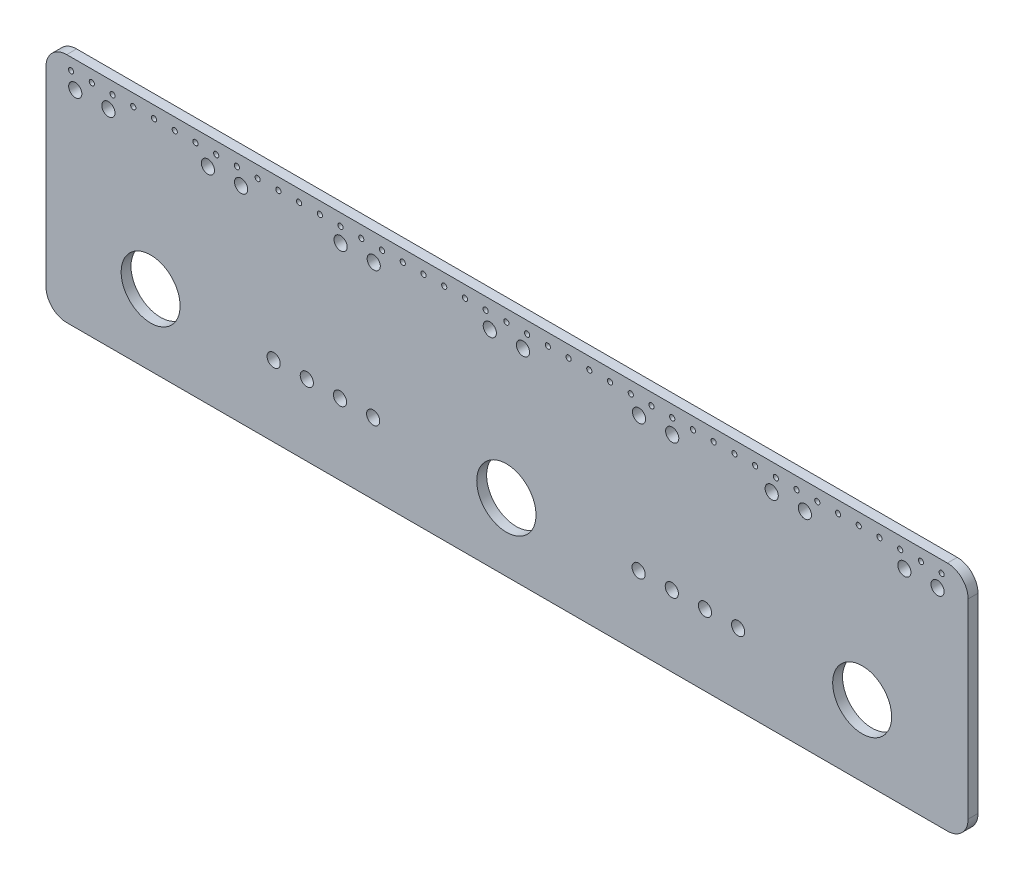
from build123d import *

# Parameters (mm, degrees)
SKETCH1_R           = 3.18
SKETCH1_R_2         = 14.225
SKETCH1_R_3         = 14.3
SKETCH1_R_4         = 1.25
BOSS_EXTRUDE1_DEPTH = 4.7625


with BuildPart() as part:
    # Sketch1 → Boss-Extrude1 (new body)
    with BuildSketch(Plane.XY):
        with BuildLine():
            Line((-577.364254813, 112.684707092), (-152.484254813, 112.684707092))
            ThreePointArc((-152.484254813, 112.684707092), (-145.413187001, 109.755774904), (-142.484254813, 102.684707092))
            Line((-142.484254813, 102.684707092), (-142.484254813, 10.684707092))
            ThreePointArc((-142.484254813, 10.684707092), (-145.413187001, 3.61363928), (-152.484254813, 0.684707092))
            Line((-152.484254813, 0.684707092), (-577.364254813, 0.684707092))
            ThreePointArc((-577.364254813, 0.684707092), (-584.435322625, 3.61363928), (-587.364254813, 10.684707092))
            Line((-587.364254813, 10.684707092), (-587.364254813, 102.684707092))
            ThreePointArc((-587.364254813, 102.684707092), (-584.435322625, 109.755774904), (-577.364254813, 112.684707092))
        make_face()
        with Locations((-301.253013333, 99.934707092)):
            Circle(SKETCH1_R, mode=Mode.SUBTRACT)
        with Locations((-285.253013333, 99.934707092)):
            Circle(SKETCH1_R, mode=Mode.SUBTRACT)
        with Locations((-237.253013333, 99.934707092)):
            Circle(SKETCH1_R, mode=Mode.SUBTRACT)
        with Locations((-221.253013333, 99.934707092)):
            Circle(SKETCH1_R, mode=Mode.SUBTRACT)
        with Locations((-173.253013333, 99.934707092)):
            Circle(SKETCH1_R, mode=Mode.SUBTRACT)
        with Locations((-157.253013333, 99.934707092)):
            Circle(SKETCH1_R, mode=Mode.SUBTRACT)
        with Locations((-445.253013333, 99.934707092)):
            Circle(SKETCH1_R, mode=Mode.SUBTRACT)
        with Locations((-429.253013333, 99.934707092)):
            Circle(SKETCH1_R, mode=Mode.SUBTRACT)
        with Locations((-509.253013333, 99.934707092)):
            Circle(SKETCH1_R, mode=Mode.SUBTRACT)
        with Locations((-493.253013333, 99.934707092)):
            Circle(SKETCH1_R, mode=Mode.SUBTRACT)
        with Locations((-573.253013333, 99.934707092)):
            Circle(SKETCH1_R, mode=Mode.SUBTRACT)
        with Locations((-557.253013333, 99.934707092)):
            Circle(SKETCH1_R, mode=Mode.SUBTRACT)
        with Locations((-357.253013333, 99.934707092)):
            Circle(SKETCH1_R, mode=Mode.SUBTRACT)
        with Locations((-373.253013333, 99.934707092)):
            Circle(SKETCH1_R, mode=Mode.SUBTRACT)
        with Locations((-536.893013333, 34.984707092)):
            Circle(SKETCH1_R_2, mode=Mode.SUBTRACT)
        with Locations((-193.613013333, 34.984707092)):
            Circle(SKETCH1_R_2, mode=Mode.SUBTRACT)
        with Locations((-365.253013333, 33.484707092)):
            Circle(SKETCH1_R_3, mode=Mode.SUBTRACT)
        with Locations((-477.53401176, 34.984707092)):
            Circle(SKETCH1_R, mode=Mode.SUBTRACT)
        with Locations((-461.53401176, 34.984707092)):
            Circle(SKETCH1_R, mode=Mode.SUBTRACT)
        with Locations((-445.53401176, 34.984707092)):
            Circle(SKETCH1_R, mode=Mode.SUBTRACT)
        with Locations((-429.53401176, 34.984707092)):
            Circle(SKETCH1_R, mode=Mode.SUBTRACT)
        with Locations((-301.443013333, 34.984707092)):
            Circle(SKETCH1_R, mode=Mode.SUBTRACT)
        with Locations((-285.443013333, 34.984707092)):
            Circle(SKETCH1_R, mode=Mode.SUBTRACT)
        with Locations((-269.443013333, 34.984707092)):
            Circle(SKETCH1_R, mode=Mode.SUBTRACT)
        with Locations((-253.443013333, 34.984707092)):
            Circle(SKETCH1_R, mode=Mode.SUBTRACT)
        with Locations((-365.253013333, 106.984707092)):
            Circle(SKETCH1_R_4, mode=Mode.SUBTRACT)
        with Locations((-355.253013333, 106.984707092)):
            Circle(SKETCH1_R_4, mode=Mode.SUBTRACT)
        with Locations((-345.253013333, 106.984707092)):
            Circle(SKETCH1_R_4, mode=Mode.SUBTRACT)
        with Locations((-335.253013333, 106.984707092)):
            Circle(SKETCH1_R_4, mode=Mode.SUBTRACT)
        with Locations((-325.253013333, 106.984707092)):
            Circle(SKETCH1_R_4, mode=Mode.SUBTRACT)
        with Locations((-315.253013333, 106.984707092)):
            Circle(SKETCH1_R_4, mode=Mode.SUBTRACT)
        with Locations((-305.253013333, 106.984707092)):
            Circle(SKETCH1_R_4, mode=Mode.SUBTRACT)
        with Locations((-295.253013333, 106.984707092)):
            Circle(SKETCH1_R_4, mode=Mode.SUBTRACT)
        with Locations((-285.253013333, 106.984707092)):
            Circle(SKETCH1_R_4, mode=Mode.SUBTRACT)
        with Locations((-275.253013333, 106.984707092)):
            Circle(SKETCH1_R_4, mode=Mode.SUBTRACT)
        with Locations((-265.253013333, 106.984707092)):
            Circle(SKETCH1_R_4, mode=Mode.SUBTRACT)
        with Locations((-255.253013333, 106.984707092)):
            Circle(SKETCH1_R_4, mode=Mode.SUBTRACT)
        with Locations((-245.253013333, 106.984707092)):
            Circle(SKETCH1_R_4, mode=Mode.SUBTRACT)
        with Locations((-235.253013333, 106.984707092)):
            Circle(SKETCH1_R_4, mode=Mode.SUBTRACT)
        with Locations((-225.253013333, 106.984707092)):
            Circle(SKETCH1_R_4, mode=Mode.SUBTRACT)
        with Locations((-215.253013333, 106.984707092)):
            Circle(SKETCH1_R_4, mode=Mode.SUBTRACT)
        with Locations((-205.253013333, 106.984707092)):
            Circle(SKETCH1_R_4, mode=Mode.SUBTRACT)
        with Locations((-195.253013333, 106.984707092)):
            Circle(SKETCH1_R_4, mode=Mode.SUBTRACT)
        with Locations((-185.253013333, 106.984707092)):
            Circle(SKETCH1_R_4, mode=Mode.SUBTRACT)
        with Locations((-175.253013333, 106.984707092)):
            Circle(SKETCH1_R_4, mode=Mode.SUBTRACT)
        with Locations((-165.253013333, 106.984707092)):
            Circle(SKETCH1_R_4, mode=Mode.SUBTRACT)
        with Locations((-155.253013333, 106.984707092)):
            Circle(SKETCH1_R_4, mode=Mode.SUBTRACT)
        with Locations((-375.253013333, 106.984707092)):
            Circle(SKETCH1_R_4, mode=Mode.SUBTRACT)
        with Locations((-385.253013333, 106.984707092)):
            Circle(SKETCH1_R_4, mode=Mode.SUBTRACT)
        with Locations((-395.253013333, 106.984707092)):
            Circle(SKETCH1_R_4, mode=Mode.SUBTRACT)
        with Locations((-405.253013333, 106.984707092)):
            Circle(SKETCH1_R_4, mode=Mode.SUBTRACT)
        with Locations((-415.253013333, 106.984707092)):
            Circle(SKETCH1_R_4, mode=Mode.SUBTRACT)
        with Locations((-425.253013333, 106.984707092)):
            Circle(SKETCH1_R_4, mode=Mode.SUBTRACT)
        with Locations((-435.253013333, 106.984707092)):
            Circle(SKETCH1_R_4, mode=Mode.SUBTRACT)
        with Locations((-445.253013333, 106.984707092)):
            Circle(SKETCH1_R_4, mode=Mode.SUBTRACT)
        with Locations((-455.253013333, 106.984707092)):
            Circle(SKETCH1_R_4, mode=Mode.SUBTRACT)
        with Locations((-465.253013333, 106.984707092)):
            Circle(SKETCH1_R_4, mode=Mode.SUBTRACT)
        with Locations((-475.253013333, 106.984707092)):
            Circle(SKETCH1_R_4, mode=Mode.SUBTRACT)
        with Locations((-485.253013333, 106.984707092)):
            Circle(SKETCH1_R_4, mode=Mode.SUBTRACT)
        with Locations((-495.253013333, 106.984707092)):
            Circle(SKETCH1_R_4, mode=Mode.SUBTRACT)
        with Locations((-505.253013333, 106.984707092)):
            Circle(SKETCH1_R_4, mode=Mode.SUBTRACT)
        with Locations((-515.253013333, 106.984707092)):
            Circle(SKETCH1_R_4, mode=Mode.SUBTRACT)
        with Locations((-525.253013333, 106.984707092)):
            Circle(SKETCH1_R_4, mode=Mode.SUBTRACT)
        with Locations((-535.253013333, 106.984707092)):
            Circle(SKETCH1_R_4, mode=Mode.SUBTRACT)
        with Locations((-545.253013333, 106.984707092)):
            Circle(SKETCH1_R_4, mode=Mode.SUBTRACT)
        with Locations((-555.253013333, 106.984707092)):
            Circle(SKETCH1_R_4, mode=Mode.SUBTRACT)
        with Locations((-565.253013333, 106.984707092)):
            Circle(SKETCH1_R_4, mode=Mode.SUBTRACT)
        with Locations((-575.253013333, 106.984707092)):
            Circle(SKETCH1_R_4, mode=Mode.SUBTRACT)
    extrude(amount=BOSS_EXTRUDE1_DEPTH)


solid = part.part
